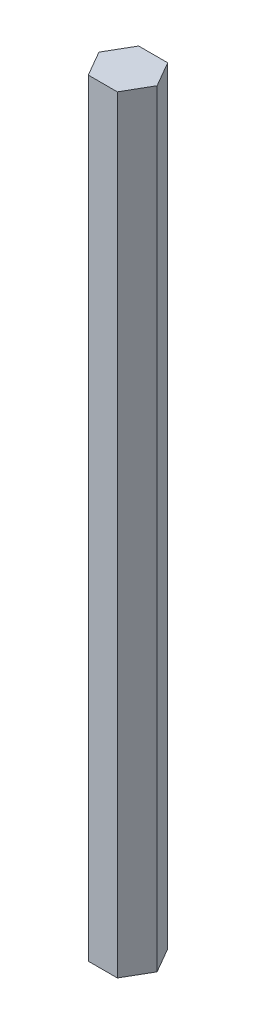
from build123d import *

# Parameters (mm, degrees)
BOSS_EXTRUDE1_DEPTH = 38.1


with BuildPart() as part:
    # Sketch1 → Boss-Extrude1 (new, symmetric)
    with BuildSketch(Plane(origin=(0, 0, 0), x_dir=(1, 0, 0), z_dir=(0, 1, 0))):
        Polygon((2.886751346, 0), (1.443375673, 2.5), (-1.443375673, 2.5), (-2.886751346, 0), (-1.443375673, -2.5), (1.443375673, -2.5), align=None)
    extrude(amount=BOSS_EXTRUDE1_DEPTH, both=True)


solid = part.part
